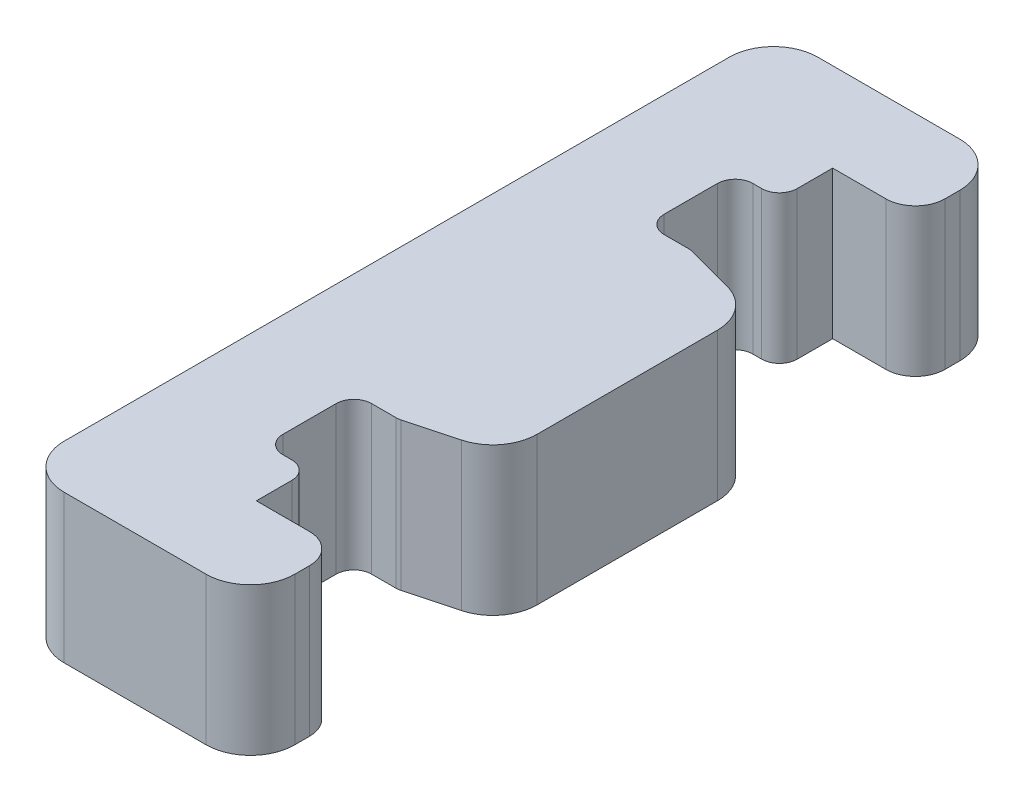
from build123d import *

# Parameters (mm, degrees)
BOSS_EXTRUDE1_DEPTH = 12.7
CUT_EXTRUDE1_DEPTH  = 38.486519244
FILLET4_R           = 1.524
FILLET5_R           = 3.81
FILLET6_R           = 2.54


with BuildPart() as part:
    # Sketch1 → Boss-Extrude1 (new body)
    with BuildSketch(Plane(origin=(0, 0, 0), x_dir=(1, 0, 0), z_dir=(0, 1, 0))):
        Polygon((5.842, 32.385), (-13.97, 32.385), (-13.97, -32.385), (5.842, -32.385), (5.842, -24.765), (-1.27, -24.765), (-1.27, -20.193), (-5.08, -20.193), (-5.08, -12.573), (-1.27, -12.573), (5.842, -12.573), (5.842, 12.573), (-1.27, 12.573), (-5.08, 12.573), (-5.08, 20.193), (-1.27, 20.193), (-1.27, 24.765), (5.842, 24.765), align=None)
    extrude(amount=BOSS_EXTRUDE1_DEPTH)

    # Sketch2 → Cut-Extrude1 (cut, through all)
    with BuildSketch(Plane(origin=(0, 12.7, 0), x_dir=(1, 0, 0), z_dir=(0, 1, 0))):
        Polygon((-1.27, -12.573), (5.842, -10.667345343), (5.842, -12.573), align=None)
        Polygon((-1.27, 12.573), (5.842, 10.667345343), (5.842, 12.573), align=None)
    extrude(amount=-CUT_EXTRUDE1_DEPTH, mode=Mode.SUBTRACT)

    # Fillet4
    fillet4_edges = [part.edges().sort_by_distance(p)[0] for p in [
        (-1.27, 6.35, -12.573),
        (-1.27, 6.35, 12.573),
        (-1.27, 6.35, 20.193),
        (-5.08, 6.35, 20.193),
        (-5.08, 6.35, 12.573),
        (-5.08, 6.35, -12.573),
        (-5.08, 6.35, -20.193),
        (-1.27, 6.35, -20.193),
    ]]
    fillet(fillet4_edges, radius=FILLET4_R)

    # Fillet5
    fillet5_edges = [part.edges().sort_by_distance(p)[0] for p in [
        (-13.97, 6.35, 32.385),
        (-13.97, 6.35, -32.385),
        (5.842, 6.35, -32.385),
        (5.842, 6.35, -10.667345343),
        (5.842, 6.35, 10.667345343),
        (5.842, 6.35, 32.385),
    ]]
    fillet(fillet5_edges, radius=FILLET5_R)

    # Fillet6
    fillet6_edges = [part.edges().sort_by_distance(p)[0] for p in [
        (5.842, 6.35, 24.765),
        (5.842, 6.35, -24.765),
    ]]
    fillet(fillet6_edges, radius=FILLET6_R)


solid = part.part
